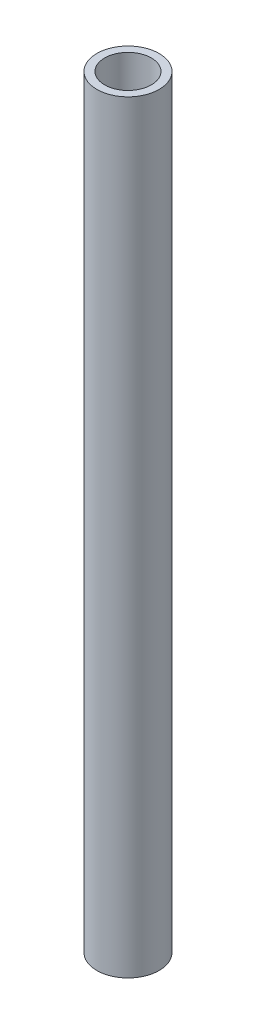
from build123d import *

# Parameters (mm, degrees)
SKETCH1_R           = 12.7
SKETCH1_R_2         = 9.525
BOSS_EXTRUDE2_DEPTH = 311.15


with BuildPart() as part:
    # Sketch1 → Boss-Extrude2 (new body)
    with BuildSketch(Plane(origin=(0, 0, 0), x_dir=(1, 0, 0), z_dir=(0, 1, 0))):
        with Locations((-391.181668083, 212.743279788)):
            Circle(SKETCH1_R)
        with Locations((-391.181668083, 212.743279788)):
            Circle(SKETCH1_R_2, mode=Mode.SUBTRACT)
    extrude(amount=BOSS_EXTRUDE2_DEPTH)


solid = part.part
